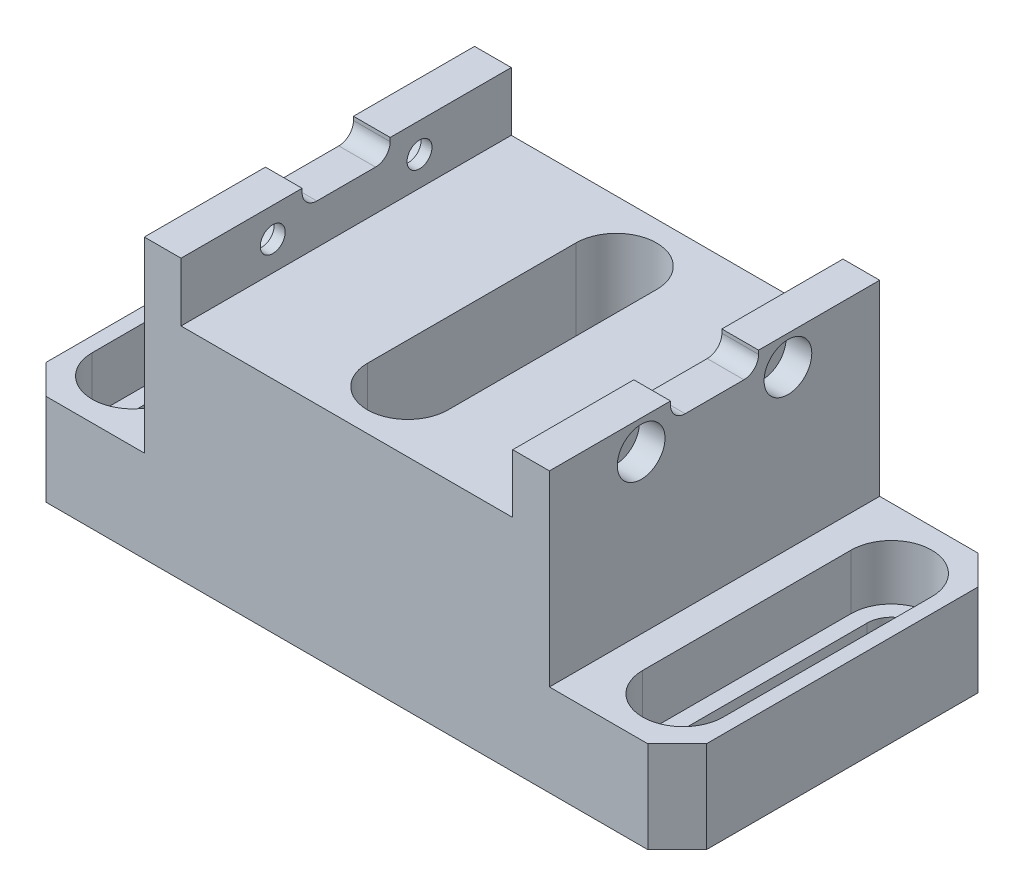
from build123d import *

# Parameters (mm, degrees)
SKETCH1_W                                           = 90
SKETCH1_H                                           = 45
BOSS_EXTRUDE1_DEPTH                                 = 30
SKETCH2_W                                           = 5
SKETCH2_H                                           = 45
BOSS_EXTRUDE2_DEPTH                                 = 8
CBORE_START                                         = 5
CBORE_SLOT_FOR_M6_HEX_SOCKET_HEAD_CAP_SC_DEPTH      = 25
CBORE_SLOT_FOR_M6_HEX_SOCKET_HEAD_CA_3_DEPTH        = 5
CHAMFER2_SIZE                                       = 4
CBORE_FOR_M3_HEX_SOCKET_HEAD_CAP_SCREW1_D           = 3.4
CBORE_FOR_M3_HEX_SOCKET_HEAD_CAP_SCREW1_DEPTH       = 5
CBORE_FOR_M3_HEX_SOCKET_HEAD_CAP_SCREW1_CBORE_D     = 6.5
CBORE_FOR_M3_HEX_SOCKET_HEAD_CAP_SCREW1_CBORE_DEPTH = 3.5
CBORE_FOR_M3_HEX_SOCKET_HEAD_CAP_SCREW2_D           = 3.4
CBORE_FOR_M3_HEX_SOCKET_HEAD_CAP_SCREW2_CBORE_D     = 6.5
CBORE_FOR_M3_HEX_SOCKET_HEAD_CAP_SCREW2_CBORE_DEPTH = 3.5
CUT_EXTRUDE1_REACH                                  = 86.977
SKETCH11_W                                          = 12
SKETCH11_H                                          = 2.5
FILLET1_R                                           = 2
CUT_EXTRUDE3_DEPTH                                  = 17.5


# Read off the part's stored shape, not the designer's step: CBORE SLOT for M6 Hex Socket Head Cap Screw1
with BuildPart() as part:
    # Sketch1 → Boss-Extrude1 (new body)
    with BuildSketch(Plane(origin=(0, 0, 0), x_dir=(1, 0, 0), z_dir=(0, 1, 0))):
        Rectangle(SKETCH1_W, SKETCH1_H)
    extrude(amount=BOSS_EXTRUDE1_DEPTH)

    # Sketch2 → Boss-Extrude2 (add)
    with BuildSketch(Plane(origin=(0, 30, 0), x_dir=(1, 0, 0), z_dir=(0, 1, 0))):
        with Locations((-25.1, 0)):
            Rectangle(SKETCH2_W, SKETCH2_H)
        with Locations((25.1, 0)):
            Rectangle(SKETCH2_W, SKETCH2_H)
    extrude(amount=BOSS_EXTRUDE2_DEPTH)

    # CBORE SLOT for M6 Hex Socket Head Ca 2 → CBORE SLOT for M6 Hex Socket Head Cap Screw1 (cut)
    with BuildSketch(Plane(origin=(0, 0, 0), x_dir=(1, 0, 0), z_dir=(0, 1, 0)).offset(CBORE_START)):
        with BuildLine():
            Line((-5.5, 14.2), (-5.5, -14.2))
            ThreePointArc((-5.5, -14.2), (0, -19.7), (5.5, -14.2))
            Line((5.5, -14.2), (5.5, 14.2))
            ThreePointArc((5.5, 14.2), (0, 19.7), (-5.5, 14.2))
        make_face()
        with BuildLine():
            Line((32, 14.2), (32, -14.2))
            ThreePointArc((32, -14.2), (37.5, -19.7), (43, -14.2))
            Line((43, -14.2), (43, 14.2))
            ThreePointArc((43, 14.2), (37.5, 19.7), (32, 14.2))
        make_face()
        with BuildLine():
            Line((-43, 14.2), (-43, -14.2))
            ThreePointArc((-43, -14.2), (-37.5, -19.7), (-32, -14.2))
            Line((-32, -14.2), (-32, 14.2))
            ThreePointArc((-32, 14.2), (-37.5, 19.7), (-43, 14.2))
        make_face()
    extrude(amount=CBORE_SLOT_FOR_M6_HEX_SOCKET_HEAD_CAP_SC_DEPTH, mode=Mode.SUBTRACT)

    # CBORE SLOT for M6 Hex Socket Head Ca 3 o → CBORE SLOT for M6 Hex Socket Head Ca 3 (cut)
    with BuildSketch(Plane(origin=(0, 0, 0), x_dir=(1, 0, 0), z_dir=(0, 1, 0))):
        with BuildLine():
            Line((-3.3, 14.2), (-3.3, -14.2))
            ThreePointArc((-3.3, -14.2), (0, -17.5), (3.3, -14.2))
            Line((3.3, -14.2), (3.3, 14.2))
            ThreePointArc((3.3, 14.2), (0, 17.5), (-3.3, 14.2))
        make_face()
        with BuildLine():
            Line((34.2, 14.2), (34.2, -14.2))
            ThreePointArc((34.2, -14.2), (37.5, -17.5), (40.8, -14.2))
            Line((40.8, -14.2), (40.8, 14.2))
            ThreePointArc((40.8, 14.2), (37.5, 17.5), (34.2, 14.2))
        make_face()
        with BuildLine():
            Line((-40.8, 14.2), (-40.8, -14.2))
            ThreePointArc((-40.8, -14.2), (-37.5, -17.5), (-34.2, -14.2))
            Line((-34.2, -14.2), (-34.2, 14.2))
            ThreePointArc((-34.2, 14.2), (-37.5, 17.5), (-40.8, 14.2))
        make_face()
    extrude(amount=CBORE_SLOT_FOR_M6_HEX_SOCKET_HEAD_CA_3_DEPTH, mode=Mode.SUBTRACT)

    # Chamfer2
    chamfer2_edges = [part.edges().sort_by_distance(p)[0] for p in [
        (-45, 15, -22.5),
        (45, 15, -22.5),
        (45, 15, 22.5),
        (-45, 15, 22.5),
    ]]
    chamfer(chamfer2_edges, length=CHAMFER2_SIZE)

    # CBORE for M3 Hex Socket Head Cap Screw1
    with Locations(Plane(origin=(27.6, 0, 0), x_dir=(0, 0, -1), z_dir=(1, 0, 0))):
        with Locations((-10, 34), (10, 34)):
            CounterBoreHole(CBORE_FOR_M3_HEX_SOCKET_HEAD_CAP_SCREW1_D / 2, CBORE_FOR_M3_HEX_SOCKET_HEAD_CAP_SCREW1_CBORE_D / 2, CBORE_FOR_M3_HEX_SOCKET_HEAD_CAP_SCREW1_CBORE_DEPTH, depth=CBORE_FOR_M3_HEX_SOCKET_HEAD_CAP_SCREW1_DEPTH)

    # CBORE for M3 Hex Socket Head Cap Screw2 (through all)
    with Locations(Plane.ZY.offset(27.6)):
        with Locations((-10, 34), (10, 34)):
            CounterBoreHole(CBORE_FOR_M3_HEX_SOCKET_HEAD_CAP_SCREW2_D / 2, CBORE_FOR_M3_HEX_SOCKET_HEAD_CAP_SCREW2_CBORE_D / 2, CBORE_FOR_M3_HEX_SOCKET_HEAD_CAP_SCREW2_CBORE_DEPTH)

    # Cut-Extrude1: up to this face of the body (flat: up to its plane)
    cut_extrude1_end = Plane(part.part.faces().sort_by_distance((-27.6, 34, 0))[0])
    # Sketch11 → Cut-Extrude1 (cut, up to the picked face)
    with BuildSketch(Plane(origin=(27.6, 0, 0), x_dir=(0, 0, -1), z_dir=(1, 0, 0)), mode=Mode.PRIVATE) as cut_extrude1_sk1:
        with Locations((0, 36.75)):
            Rectangle(SKETCH11_W, SKETCH11_H)
    cut_extrude1_tool1 = split(extrude(cut_extrude1_sk1.sketch, amount=-CUT_EXTRUDE1_REACH, mode=Mode.PRIVATE), bisect_by=cut_extrude1_end, keep=Keep.BOTH, mode=Mode.PRIVATE)
    add(cut_extrude1_tool1.solids().sort_by(Axis((27.6, 36.75, 0), (-1, 0, 0)))[0], mode=Mode.SUBTRACT)

    # Fillet1
    fillet1_edges = [part.edges().sort_by_distance(p)[0] for p in [
        (-25.1, 35.5, -6),
        (25.1, 35.5, -6),
        (-25.1, 35.5, 6),
        (25.1, 35.5, 6),
    ]]
    fillet(fillet1_edges, radius=FILLET1_R)

    # Sketch13 → Cut-Extrude3 (cut)
    with BuildSketch(Plane(origin=(0, 30, 0), x_dir=(1, 0, 0), z_dir=(0, 1, 0))):
        Polygon((-45, 18.5), (-45, -18.5), (-41, -22.5), (-27.6, -22.5), (-27.6, 22.5), (-41, 22.5), align=None)
        Polygon((45, -18.5), (45, 18.5), (41, 22.5), (27.6, 22.5), (27.6, -22.5), (41, -22.5), align=None)
    extrude(amount=-CUT_EXTRUDE3_DEPTH, mode=Mode.SUBTRACT)


solid = part.part
